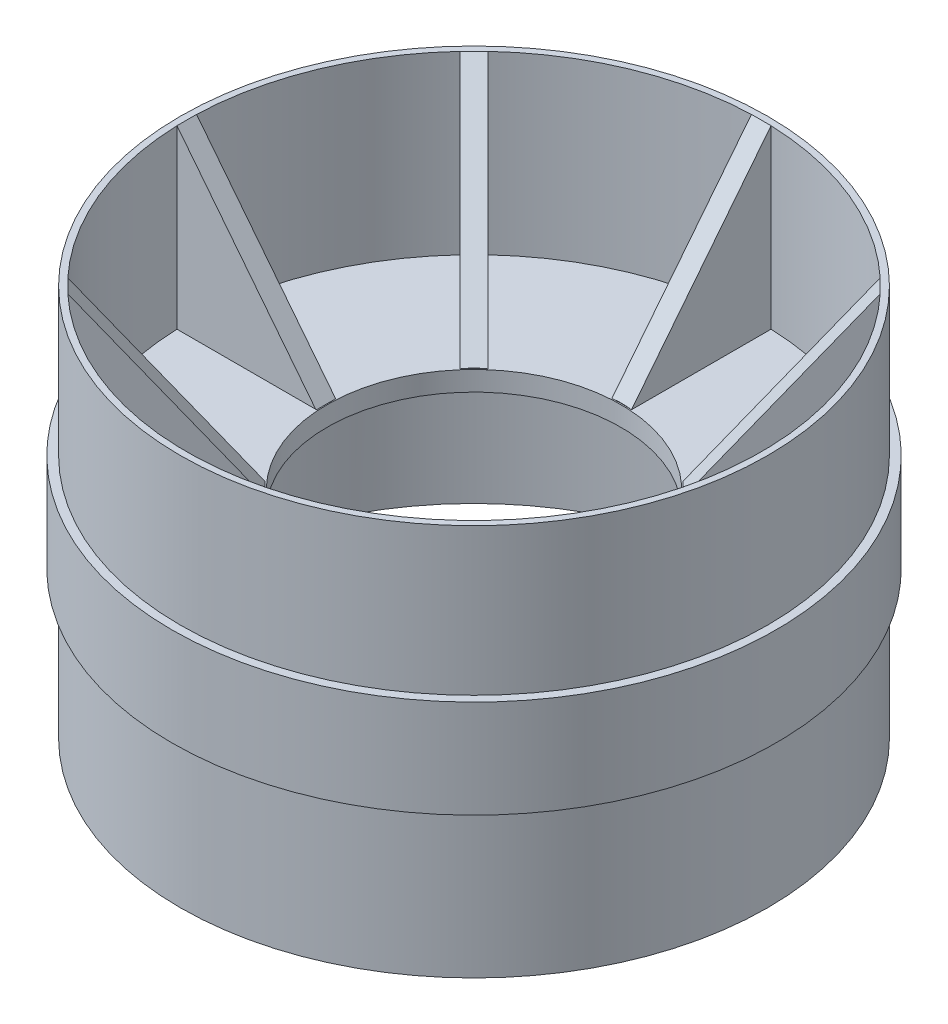
from build123d import *

# Parameters (mm, degrees)
SKETCH1_R            = 78.359
SKETCH1_R_2          = 74.549
BOSS_EXTRUDE1_DEPTH  = 25.4
SKETCH2_R            = 76.2
SKETCH2_R_2          = 74.549
BOSS_EXTRUDE2_DEPTH  = 38.1
BOSS_EXTRUDE3_START  = 38.1
SKETCH3_R            = 76.2
SKETCH3_R_2          = 74.549
BOSS_EXTRUDE3_DEPTH  = 38.1
SKETCH4_R            = 74.549
SKETCH4_R_2          = 38.1
BOSS_EXTRUDE4_DEPTH  = 5.08
BOSS_EXTRUDE10_DEPTH = 45.72
CUT_EXTRUDE1_DEPTH   = 5.08
CUT_EXTRUDE2_DEPTH   = 5.08
CUT_EXTRUDE3_DEPTH   = 5.08
CUT_EXTRUDE4_DEPTH   = 5.08
CUT_EXTRUDE5_DEPTH   = 5.08
CUT_EXTRUDE6_DEPTH   = 5.08
CUT_EXTRUDE7_DEPTH   = 5.08
CUT_EXTRUDE8_DEPTH   = 5.08


with BuildPart() as part:
    # Sketch1 → Boss-Extrude1 (new body)
    with BuildSketch(Plane(origin=(0, 0, 0), x_dir=(1, 0, 0), z_dir=(0, 1, 0))):
        Circle(SKETCH1_R)
        Circle(SKETCH1_R_2, mode=Mode.SUBTRACT)
    extrude(amount=BOSS_EXTRUDE1_DEPTH)

    # Sketch2 → Boss-Extrude2 (add)
    with BuildSketch(Plane(origin=(0, 25.4, 0), x_dir=(1, 0, 0), z_dir=(0, 1, 0))):
        Circle(SKETCH2_R)
        Circle(SKETCH2_R_2, mode=Mode.SUBTRACT)
    extrude(amount=BOSS_EXTRUDE2_DEPTH)

    # Sketch3 → Boss-Extrude3 (add)
    with BuildSketch(Plane.XZ.offset(BOSS_EXTRUDE3_START)):
        Circle(SKETCH3_R)
        Circle(SKETCH3_R_2, mode=Mode.SUBTRACT)
    extrude(amount=-BOSS_EXTRUDE3_DEPTH)

    # Sketch4 → Boss-Extrude4 (add)
    with BuildSketch(Plane(origin=(0, 12.7, 0), x_dir=(1, 0, 0), z_dir=(0, 1, 0))):
        Circle(SKETCH4_R)
        Circle(SKETCH4_R_2, mode=Mode.SUBTRACT)
    extrude(amount=BOSS_EXTRUDE4_DEPTH)

    # Sketch5 → Boss-Extrude10 (add)
    with BuildSketch(Plane(origin=(0, 17.78, 0), x_dir=(1, 0, 0), z_dir=(0, 1, 0))):
        with BuildLine():
            Line((38.308544026, 2.54), (74.505716566, 2.54))
            ThreePointArc((74.505716566, 2.54), (74.549, 0), (74.505716566, -2.54))
            Line((74.505716566, -2.54), (38.308544026, -2.54))
            ThreePointArc((38.308544026, -2.54), (38.392657442, 0), (38.308544026, 2.54))
        make_face()
        with BuildLine():
            Line((28.884282483, -25.292180034), (54.479548645, -50.887446197))
            ThreePointArc((54.479548645, -50.887446197), (52.714103431, -52.714103431), (50.887446197, -54.479548645))
            Line((50.887446197, -54.479548645), (25.292180034, -28.884282483))
            ThreePointArc((25.292180034, -28.884282483), (27.147708425, -27.147708425), (28.884282483, -25.292180034))
        make_face()
        with BuildLine():
            Line((2.54, -38.308544026), (2.54, -74.505716566))
            ThreePointArc((2.54, -74.505716566), (0, -74.549), (-2.54, -74.505716566))
            Line((-2.54, -74.505716566), (-2.54, -38.308544026))
            ThreePointArc((-2.54, -38.308544026), (0, -38.392657442), (2.54, -38.308544026))
        make_face()
        with BuildLine():
            Line((-25.292180034, -28.884282483), (-50.887446197, -54.479548645))
            ThreePointArc((-50.887446197, -54.479548645), (-52.714103431, -52.714103431), (-54.479548645, -50.887446197))
            Line((-54.479548645, -50.887446197), (-28.884282483, -25.292180034))
            ThreePointArc((-28.884282483, -25.292180034), (-27.147708425, -27.147708425), (-25.292180034, -28.884282483))
        make_face()
        with BuildLine():
            Line((-38.308544026, -2.54), (-74.505716566, -2.54))
            ThreePointArc((-74.505716566, -2.54), (-74.549, 0), (-74.505716566, 2.54))
            Line((-74.505716566, 2.54), (-38.308544026, 2.54))
            ThreePointArc((-38.308544026, 2.54), (-38.392657442, 0), (-38.308544026, -2.54))
        make_face()
        with BuildLine():
            Line((-28.884282483, 25.292180034), (-54.479548645, 50.887446197))
            ThreePointArc((-54.479548645, 50.887446197), (-52.714103431, 52.714103431), (-50.887446197, 54.479548645))
            Line((-50.887446197, 54.479548645), (-25.292180034, 28.884282483))
            ThreePointArc((-25.292180034, 28.884282483), (-27.147708425, 27.147708425), (-28.884282483, 25.292180034))
        make_face()
        with BuildLine():
            Line((-2.54, 38.308544026), (-2.54, 74.505716566))
            ThreePointArc((-2.54, 74.505716566), (0, 74.549), (2.54, 74.505716566))
            Line((2.54, 74.505716566), (2.54, 38.308544026))
            ThreePointArc((2.54, 38.308544026), (0, 38.392657442), (-2.54, 38.308544026))
        make_face()
        with BuildLine():
            Line((25.292180034, 28.884282483), (50.887446197, 54.479548645))
            ThreePointArc((50.887446197, 54.479548645), (52.714103431, 52.714103431), (54.479548645, 50.887446197))
            Line((54.479548645, 50.887446197), (28.884282483, 25.292180034))
            ThreePointArc((28.884282483, 25.292180034), (27.147708425, 27.147708425), (25.292180034, 28.884282483))
        make_face()
    extrude(amount=BOSS_EXTRUDE10_DEPTH)

    # Sketch6 → Cut-Extrude1 (cut)
    with BuildSketch(Plane.XY.offset(2.54)):
        Polygon((74.505716566, 63.5), (38.308544026, 17.78), (38.308544026, 63.5), align=None)
    extrude(amount=-CUT_EXTRUDE1_DEPTH, mode=Mode.SUBTRACT)

    # Sketch7 → Cut-Extrude2 (cut)
    with BuildSketch(Plane(origin=(1.796051224, 0, 1.796051224), x_dir=(0.707106781186556, 0, -0.707106781186539), z_dir=(0.707106781186539, 0, 0.707106781186556))):
        Polygon((74.505716566, 63.5), (38.308544026, 17.78), (38.308544026, 63.5), align=None)
    extrude(amount=-CUT_EXTRUDE2_DEPTH, mode=Mode.SUBTRACT)

    # Sketch8 → Cut-Extrude3 (cut)
    with BuildSketch(Plane(origin=(2.54, 0, 0), x_dir=(0, 0, -1), z_dir=(1, 0, 0))):
        Polygon((74.505716566, 63.5), (38.308544026, 17.78), (38.308544026, 63.5), align=None)
    extrude(amount=-CUT_EXTRUDE3_DEPTH, mode=Mode.SUBTRACT)

    # Sketch9 → Cut-Extrude4 (cut)
    with BuildSketch(Plane(origin=(-1.796051224, 0, 1.796051224), x_dir=(0.7071067811865415, 0, 0.7071067811865536), z_dir=(-0.7071067811865536, 0, 0.7071067811865415))):
        Polygon((-74.505716566, 63.5), (-38.308544026, 17.78), (-38.308544026, 63.5), align=None)
    extrude(amount=-CUT_EXTRUDE4_DEPTH, mode=Mode.SUBTRACT)

    # Sketch10 → Cut-Extrude5 (cut)
    with BuildSketch(Plane.XY.offset(2.54)):
        Polygon((-74.505716566, 63.5), (-38.308544026, 17.510269731), (-38.308544026, 63.5), align=None)
    extrude(amount=-CUT_EXTRUDE5_DEPTH, mode=Mode.SUBTRACT)

    # Sketch11 → Cut-Extrude6 (cut)
    with BuildSketch(Plane(origin=(1.796051224, 0, 1.796051224), x_dir=(0.7071067811865513, 0, -0.7071067811865437), z_dir=(0.7071067811865437, 0, 0.7071067811865513))):
        Polygon((-74.505716566, 63.5), (-38.308544026, 17.78), (-38.308544026, 63.5), align=None)
    extrude(amount=-CUT_EXTRUDE6_DEPTH, mode=Mode.SUBTRACT)

    # Sketch12 → Cut-Extrude7 (cut)
    with BuildSketch(Plane.ZY.offset(2.54)):
        Polygon((74.505716566, 63.5), (38.308544026, 17.78), (38.308544026, 63.5), align=None)
    extrude(amount=-CUT_EXTRUDE7_DEPTH, mode=Mode.SUBTRACT)

    # Sketch13 → Cut-Extrude8 (cut)
    with BuildSketch(Plane(origin=(-1.796051224, 0, 1.796051224), x_dir=(0.7071067811865465, 0, 0.7071067811865487), z_dir=(-0.7071067811865487, 0, 0.7071067811865465))):
        Polygon((74.505716566, 63.5), (38.308544026, 17.78), (38.308544026, 63.5), align=None)
    extrude(amount=-CUT_EXTRUDE8_DEPTH, mode=Mode.SUBTRACT)


solid = part.part
